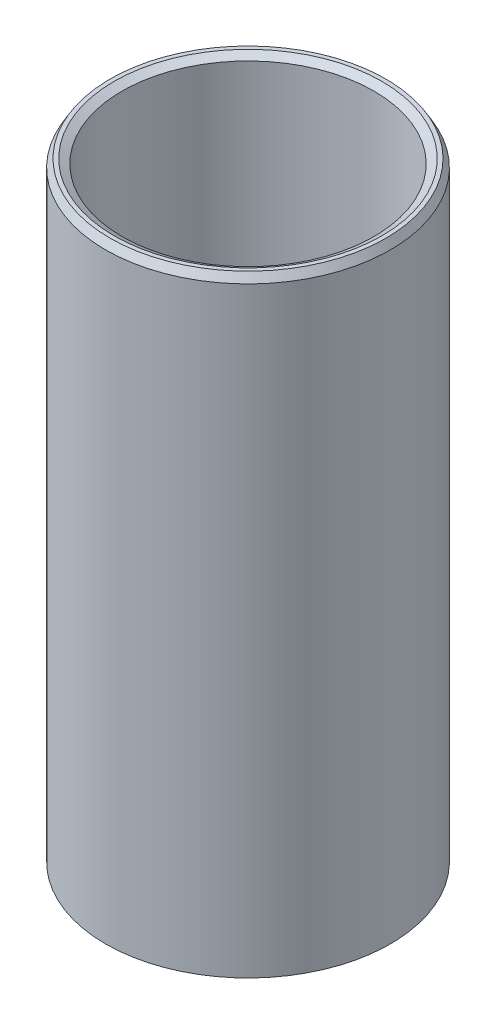
from build123d import *
from OCP.BRepFilletAPI import BRepFilletAPI_MakeChamfer

# Parameters (mm, degrees)
SKETCH1_R           = 42.5
BOSS_EXTRUDE1_DEPTH = 183.049954021
SKETCH2_R           = 37.598591873
CUT_EXTRUDE1_DEPTH  = 193.664957029
CHAMFER1_SIZE       = 2.340574628
CHAMFER1_SIZE2      = 1.351331391


with BuildPart() as part:
    # Sketch1 → Boss-Extrude1 (new body)
    with BuildSketch(Plane(origin=(0, 0, 0), x_dir=(1, 0, 0), z_dir=(0, 1, 0))):
        Circle(SKETCH1_R)
    extrude(amount=BOSS_EXTRUDE1_DEPTH)

    # Sketch2 → Cut-Extrude1 (cut, through all)
    with BuildSketch(Plane(origin=(0, 0, 0), x_dir=(1, 0, 0), z_dir=(0, 1, 0))):
        Circle(SKETCH2_R)
    extrude(amount=CUT_EXTRUDE1_DEPTH, mode=Mode.SUBTRACT)

    # Chamfer1: one chamfer whose edges measure the first distance from different faces: ONE call of the kernel's chamfer builder (chamfer() names one face for all edges)
    chamfer1_edges_1 = [part.edges().sort_by_distance(p)[0] for p in [
        (-37.598591873, 183.049954021, 0),
    ]]
    chamfer1_side_1 = [part.faces().sort_by_distance(p)[0] for p in [
        (-41.297918472, 183.049954021, 0),
    ]]
    chamfer1_edges_2 = [part.edges().sort_by_distance(p)[0] for p in [
        (-37.598591873, 0, 0),
    ]]
    chamfer1_side_2 = [part.faces().sort_by_distance(p)[0] for p in [
        (-37.598591873, 91.52497701, 0),
    ]]
    chamfer1_edges_3 = [part.edges().sort_by_distance(p)[0] for p in [
        (-42.5, 0, 0),
    ]]
    chamfer1_side_3 = [part.faces().sort_by_distance(p)[0] for p in [
        (-41.297918472, 0, 0),
    ]]
    chamfer1_edges_4 = [part.edges().sort_by_distance(p)[0] for p in [
        (-42.5, 183.049954021, 0),
    ]]
    chamfer1_side_4 = [part.faces().sort_by_distance(p)[0] for p in [
        (-42.5, 91.52497701, 0),
    ]]
    chamfer1 = BRepFilletAPI_MakeChamfer(part.part.solid().wrapped)
    for e in chamfer1_edges_1:
        chamfer1.Add(CHAMFER1_SIZE, CHAMFER1_SIZE2, e.wrapped, chamfer1_side_1[0].wrapped)  # the first distance lies on this face
    for e in chamfer1_edges_2:
        chamfer1.Add(CHAMFER1_SIZE, CHAMFER1_SIZE2, e.wrapped, chamfer1_side_2[0].wrapped)  # the first distance lies on this face
    for e in chamfer1_edges_3:
        chamfer1.Add(CHAMFER1_SIZE, CHAMFER1_SIZE2, e.wrapped, chamfer1_side_3[0].wrapped)  # the first distance lies on this face
    for e in chamfer1_edges_4:
        chamfer1.Add(CHAMFER1_SIZE, CHAMFER1_SIZE2, e.wrapped, chamfer1_side_4[0].wrapped)  # the first distance lies on this face
    add(Compound.cast(chamfer1.Shape()), mode=Mode.REPLACE)


solid = part.part
